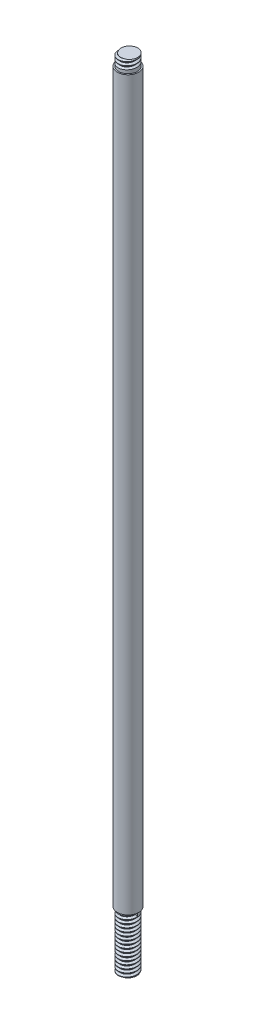
from build123d import *

# Parameters (mm, degrees)
SKETCH1_R           = 2.38125
BOSS_EXTRUDE1_DEPTH = 177.8
SKETCH2_R           = 2.38125
SKETCH2_R_2         = 2.0828
CUT_EXTRUDE1_DEPTH  = 12.7
THREAD1_PITCH       = 0.79375
CUT_EXTRUDE2_START  = -2.54
SKETCH3_R           = 2.38125
SKETCH3_R_2         = 2.085588765
CUT_EXTRUDE2_DEPTH  = 2.54
THREAD2_PITCH       = 0.79375


with BuildPart() as part:
    # Sketch1 → Boss-Extrude1 (new body)
    with BuildSketch(Plane(origin=(0, 0, 0), x_dir=(1, 0, 0), z_dir=(0, 1, 0))):
        with Locations(Location((0, 0, 0), (0, 0, 270))):
            Circle(SKETCH1_R)
    extrude(amount=BOSS_EXTRUDE1_DEPTH)

    # Sketch2 → Cut-Extrude1 (cut)
    with BuildSketch(Plane.XZ):
        with Locations(Location((0, 0, 0), (0, 0, 270))):
            Circle(SKETCH2_R)
        with Locations(Location((0, 0, 0), (0, 0, 270))):
            Circle(SKETCH2_R_2, mode=Mode.SUBTRACT)
    extrude(amount=-CUT_EXTRUDE1_DEPTH, mode=Mode.SUBTRACT)

    # Thread1: the profile of Thread Profile1 profile screwed along a right-hand helix of 16 turns, 8 arcs to a turn; built about Z, then put on its axis
    thread1_z = Axis((0, 0, 0), (0, 0, 1))
    thread1_corners = [(2.0831, 0, -0.000173205), (2.0831, 0, 0.694704453), (1.653170212, 0, 0.446484374), (1.653170212, 0, 0.248046874)]
    with BuildLine(mode=Mode.PRIVATE) as thread1_profile:
        Line(thread1_corners[0], thread1_corners[1])
        Line(thread1_corners[1], thread1_corners[2])
        Line(thread1_corners[2], thread1_corners[3])
        Line(thread1_corners[3], thread1_corners[0])
    thread1_cap = Face(thread1_profile.wire())
    thread1_turn_angles = [0, 22.5, 45, 67.5, 90, 112.5, 135, 157.5, 180, 202.5, 225, 247.5, 270, 292.5, 315, 337.5, 360]
    thread1_turn_weights = [1, 0.9238795325112867, 1, 0.9238795325112867, 1, 0.9238795325112867, 1, 0.9238795325112867, 1, 0.9238795325112867, 1, 0.9238795325112867, 1, 0.9238795325112867, 1, 0.9238795325112867, 1]
    thread1_turn_rails = [Edge.make_bspline([Vector(p[0], p[1], 0).rotate(thread1_z, thread1_turn_angles[k]) / thread1_turn_weights[k] + Vector(0, 0, p[2] + THREAD1_PITCH * thread1_turn_angles[k] / 360) for k in range(17)], [0, 0, 0, 1, 1, 2, 2, 3, 3, 4, 4, 5, 5, 6, 6, 7, 7, 8, 8, 8], 2, thread1_turn_weights) for p in thread1_corners]
    thread1_turn_sides = [Face.make_surface_from_curves(thread1_turn_rails[p[0]], thread1_turn_rails[p[1]]) for p in [(0, 1), (1, 2), (2, 3), (3, 0)]]
    thread1 = Plane(origin=(0, -1, 0), x_dir=(1, 0, 0), z_dir=(0, 1, 0)) * Solid(Shell([*[p.moved(Location((0, 0, THREAD1_PITCH * i))) for i in range(16) for p in thread1_turn_sides], thread1_cap, thread1_cap.rotate(thread1_z, 5760).moved(Location((0, 0, THREAD1_PITCH * 5760 / 360)))]))
    add(thread1, mode=Mode.SUBTRACT)

    # Sketch3 → Cut-Extrude2 (cut)
    with BuildSketch(Plane(origin=(0, 177.8, 0), x_dir=(1, 0, 0), z_dir=(0, 1, 0)).offset(CUT_EXTRUDE2_START)):
        with Locations(Location((0, 0, 0), (0, 0, 90))):
            Circle(SKETCH3_R)
        with Locations(Location((0, 0, 0), (0, 0, 270))):
            Circle(SKETCH3_R_2, mode=Mode.SUBTRACT)
    extrude(amount=CUT_EXTRUDE2_DEPTH, mode=Mode.SUBTRACT)

    # Thread2: the profile of Thread Profile2 profile screwed along a right-hand helix of 3.2 turns, 8 arcs to a turn; built about Z, then put on its axis
    thread2_z = Axis((0, 0, 0), (0, 0, 1))
    thread2_corners = [(2.085888765, 0, -0.000173205), (2.085888765, 0, 0.694704453), (1.655958977, 0, 0.446484374), (1.655958977, 0, 0.248046874)]
    with BuildLine(mode=Mode.PRIVATE) as thread2_profile:
        Line(thread2_corners[0], thread2_corners[1])
        Line(thread2_corners[1], thread2_corners[2])
        Line(thread2_corners[2], thread2_corners[3])
        Line(thread2_corners[3], thread2_corners[0])
    thread2_cap = Face(thread2_profile.wire())
    thread2_turn_angles = [0, 22.5, 45, 67.5, 90, 112.5, 135, 157.5, 180, 202.5, 225, 247.5, 270, 292.5, 315, 337.5, 360]
    thread2_turn_weights = [1, 0.9238795325112867, 1, 0.9238795325112867, 1, 0.9238795325112867, 1, 0.9238795325112867, 1, 0.9238795325112867, 1, 0.9238795325112867, 1, 0.9238795325112867, 1, 0.9238795325112867, 1]
    thread2_turn_rails = [Edge.make_bspline([Vector(p[0], p[1], 0).rotate(thread2_z, thread2_turn_angles[k]) / thread2_turn_weights[k] + Vector(0, 0, p[2] + THREAD2_PITCH * thread2_turn_angles[k] / 360) for k in range(17)], [0, 0, 0, 1, 1, 2, 2, 3, 3, 4, 4, 5, 5, 6, 6, 7, 7, 8, 8, 8], 2, thread2_turn_weights) for p in thread2_corners]
    thread2_turn_sides = [Face.make_surface_from_curves(thread2_turn_rails[p[0]], thread2_turn_rails[p[1]]) for p in [(0, 1), (1, 2), (2, 3), (3, 0)]]
    thread2_last_angles = [1080, 1102.5, 1125, 1138.5, 1152]
    thread2_last_weights = [1, 0.9238795325112867, 1, 0.9723699203976766, 1]
    thread2_last_rails = [Edge.make_bspline([Vector(p[0], p[1], 0).rotate(thread2_z, thread2_last_angles[k]) / thread2_last_weights[k] + Vector(0, 0, p[2] + THREAD2_PITCH * thread2_last_angles[k] / 360) for k in range(5)], [0, 0, 0, 1, 1, 2, 2, 2], 2, thread2_last_weights) for p in thread2_corners]
    thread2_last_sides = [Face.make_surface_from_curves(thread2_last_rails[p[0]], thread2_last_rails[p[1]]) for p in [(0, 1), (1, 2), (2, 3), (3, 0)]]
    thread2 = Plane(origin=(0, 178.8, 0), x_dir=(-1, 0, 0), z_dir=(0, -1, 0)) * Solid(Shell([*[p.moved(Location((0, 0, THREAD2_PITCH * i))) for i in range(3) for p in thread2_turn_sides], *thread2_last_sides, thread2_cap, thread2_cap.rotate(thread2_z, 1152).moved(Location((0, 0, THREAD2_PITCH * 1152 / 360)))]))
    add(thread2, mode=Mode.SUBTRACT)


solid = part.part
